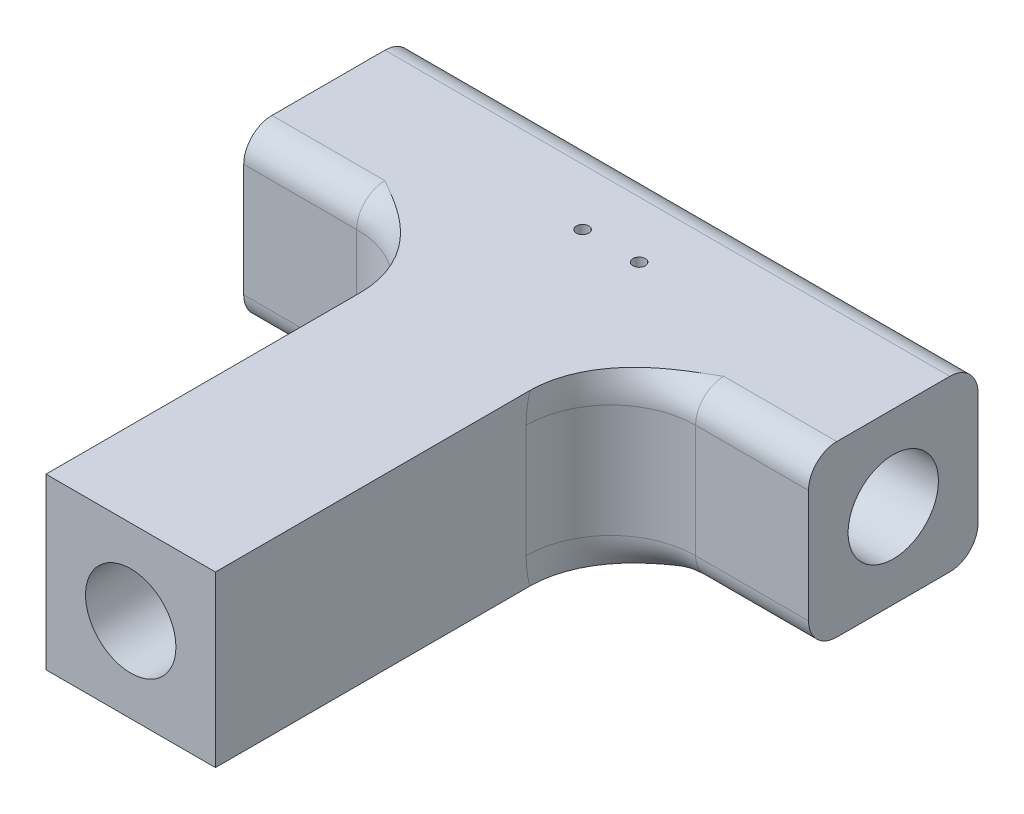
from build123d import *

# Parameters (mm, degrees)
SKETCH1_W                    = 10
SKETCH1_H                    = 3
BOSS_EXTRUDE1_DEPTH          = 3
F_90_0_0087_DIAMETER_HOLE1_D = 0.22098
SKETCH15_W                   = 3
SKETCH15_H                   = 3
BOSS_EXTRUDE2_DEPTH          = 7
M2X0_4_TAPPED_HOLE1_D        = 1.6
M2X0_4_TAPPED_HOLE1_DEPTH    = 5
M2X0_4_TAPPED_HOLE1_TIP      = 0.480688495
FILLET4_R                    = 0.5
FILLET3_R                    = 1.5


with BuildPart() as part:
    # Sketch1 → Boss-Extrude1 (new body)
    with BuildSketch(Plane(origin=(0, 0, 0), x_dir=(1, 0, 0), z_dir=(0, 1, 0))):
        Rectangle(SKETCH1_W, SKETCH1_H)
    extrude(amount=BOSS_EXTRUDE1_DEPTH)

    # #90 (0.0087) Diameter Hole1 (through all)
    with Locations(Plane(origin=(0, 3, 0), x_dir=(1, 0, 0), z_dir=(0, 1, 0))):
        with Locations((0.5, 0), (-0.5, 0)):
            Hole(F_90_0_0087_DIAMETER_HOLE1_D / 2)

    # Sketch8 → Tap Drill for M2x0.4 Tap1 (revolve, cut)
    with BuildSketch(Plane(origin=(-5, 1.5, 0), x_dir=(0, 0, 1), z_dir=(0, 1, 0))):
        Polygon((0, 0), (0, 4.85), (0.8, 4.369311505), (0.8, 0), align=None)
    tap_drill_for_m2x0_4_tap1 = revolve(axis=Axis((-11.35, 1.5, 0), (1, 0, 0)), mode=Mode.SUBTRACT)

    # Mirror1: Tap Drill for M2x0.4 Tap1 across plane
    add(tap_drill_for_m2x0_4_tap1.mirror(Plane(origin=(0, 0, 0), x_dir=(0, 0, 1), z_dir=(1, 0, 0))), mode=Mode.SUBTRACT)

    # Sketch15 → Boss-Extrude2 (add)
    with BuildSketch(Plane.XY.offset(1.5)):
        with Locations((0, 1.5)):
            Rectangle(SKETCH15_W, SKETCH15_H)
    extrude(amount=BOSS_EXTRUDE2_DEPTH)

    # M2x0.4 Tapped Hole1
    with Locations(Plane.XY.offset(8.5)):
        with Locations((0, 1.5)):
            Hole(M2X0_4_TAPPED_HOLE1_D / 2, depth=M2X0_4_TAPPED_HOLE1_DEPTH)
            with Locations((0, 0, -(M2X0_4_TAPPED_HOLE1_DEPTH + M2X0_4_TAPPED_HOLE1_TIP / 2))):  # 118° drill point
                Cone(0, M2X0_4_TAPPED_HOLE1_D / 2, M2X0_4_TAPPED_HOLE1_TIP, mode=Mode.SUBTRACT)

    # Fillet4
    fillet4_edges = [part.edges().sort_by_distance(p)[0] for p in [
        (3.25, 3, 1.5),
        (3.25, 0, 1.5),
        (-3.25, 0, 1.5),
        (0, 0, -1.5),
        (0, 3, -1.5),
        (-3.25, 3, 1.5),
    ]]
    fillet(fillet4_edges, radius=FILLET4_R)

    # Fillet3
    fillet3_edges = [part.edges().sort_by_distance(p)[0] for p in [
        (-1.5, 1.5, 1.5),
        (-1.5, 0.146446609, 1.353553391),
        (-1.5, 2.853553391, 1.353553391),
    ]]
    fillet(fillet3_edges, radius=FILLET3_R)
    fillet3_2_edges = [part.edges().sort_by_distance(p)[0] for p in [
        (1.5, 2.853553391, 1.353553391),
        (1.5, 1.5, 1.5),
        (1.5, 0.146446609, 1.353553391),
    ]]
    fillet(fillet3_2_edges, radius=FILLET3_R)


solid = part.part
